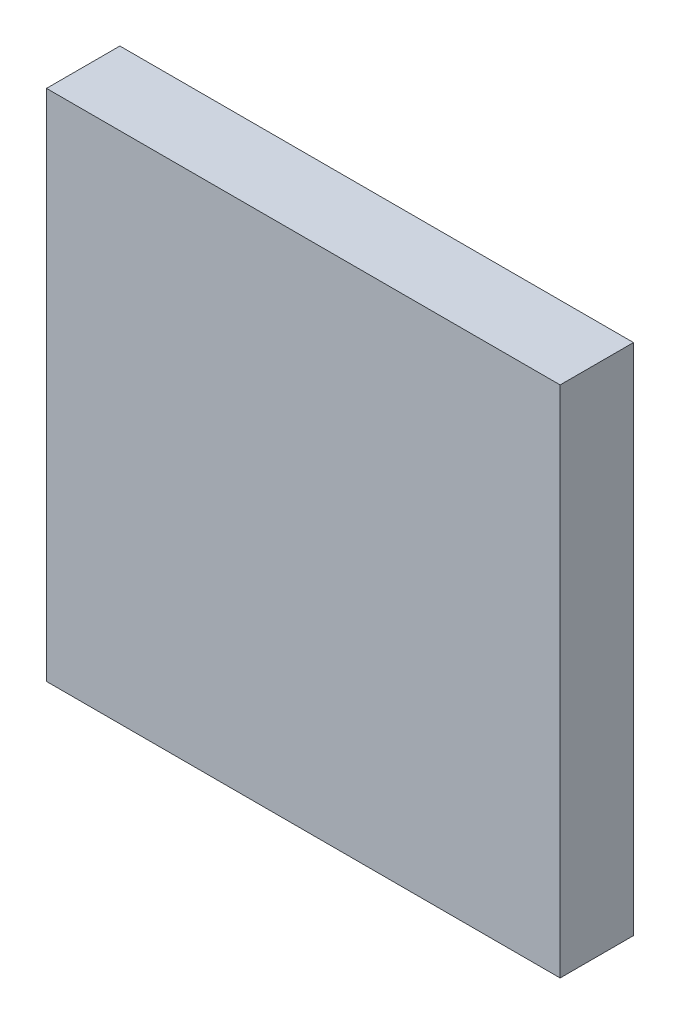
from build123d import *

# Parameters (mm, degrees)
SKETCH2_W           = 35
SKETCH2_H           = 35
BOSS_EXTRUDE1_DEPTH = 5


with BuildPart() as part:
    # Sketch2 → Boss-Extrude1 (new body)
    with BuildSketch(Plane.XY):
        Rectangle(SKETCH2_W, SKETCH2_H)
    extrude(amount=BOSS_EXTRUDE1_DEPTH)


solid = part.part
